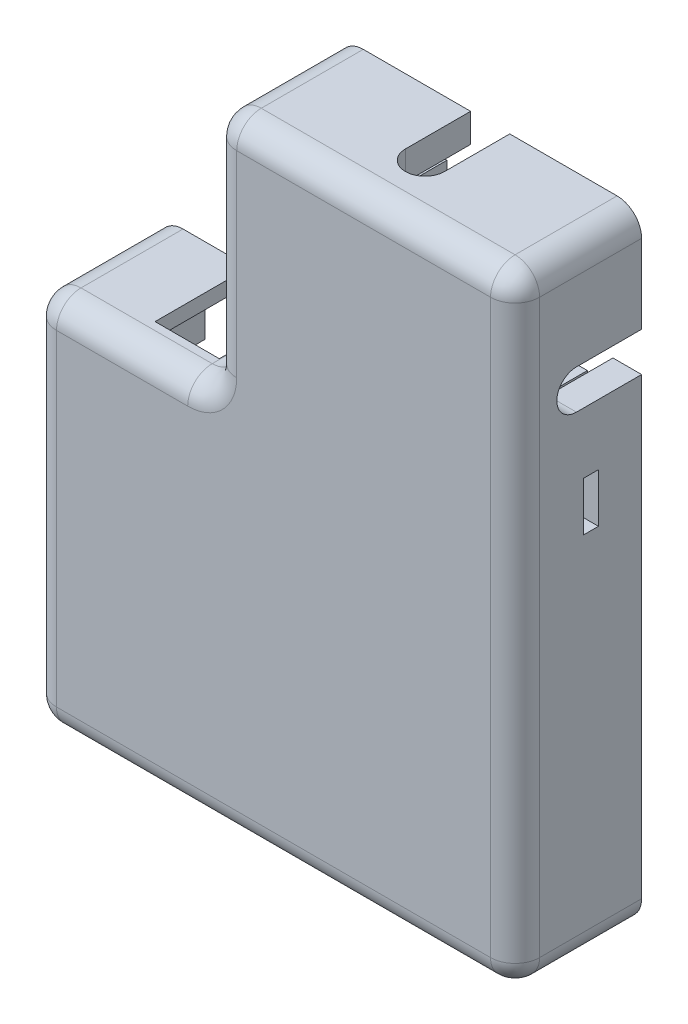
from build123d import *

# Parameters (mm, degrees)
BOSS_EXTRUDE1_DEPTH = 4
BOSS_EXTRUDE2_DEPTH = 21.8
BOSS_EXTRUDE3_START = 55.9
BOSS_EXTRUDE3_DEPTH = 5.85
BOSS_EXTRUDE4_START = 81.25
BOSS_EXTRUDE4_DEPTH = 5.85
SKETCH5_W           = 13.1
SKETCH5_H           = 3
BOSS_EXTRUDE5_DEPTH = 2.6
FILLET1_R           = 5
FILLET2_R           = 3
SKETCH6_W           = 3
SKETCH6_H           = 8.0544
SKETCH6_W_2         = 8.0544
SKETCH6_H_2         = 3
BOSS_EXTRUDE6_DEPTH = 0.889
FILLET3_R           = 3
FILLET4_R           = 1.4
FILLET5_R           = 1
SKETCH8_W           = 3
SKETCH8_H           = 10
CUT_EXTRUDE1_DEPTH  = 3
SKETCH9_W           = 3
SKETCH9_H           = 10
CUT_EXTRUDE2_DEPTH  = 3
SKETCH10_W          = 10
SKETCH10_H          = 3
CUT_EXTRUDE3_DEPTH  = 3


# Read off the part's stored shape, not the designer's step: Boss-Extrude3, Boss-Extrude4
# Some blends are built 0.0001 mm under size
with BuildPart() as part:
    # Sketch1 → Boss-Extrude1 (new body)
    with BuildSketch(Plane.XY):
        Polygon((-36.75, 37), (-36.75, -39.5), (61.75, -39.5), (61.75, 87.1), (0, 87.1), (0, 37), align=None)
    extrude(amount=BOSS_EXTRUDE1_DEPTH)

    # Sketch2 → Boss-Extrude2 (add)
    with BuildSketch(Plane(origin=(0, 0, 0), x_dir=(-1, 0, 0), z_dir=(0, 0, -1))):
        Polygon((5.15, 34), (-3, 34), (-3, 84.1), (-23.8825, 84.1), (-23.8825, 81.25), (-26.8825, 81.25), (-26.8825, 87.1), (0, 87.1), (0, 37), (5.15, 37), align=None)
        Polygon((-34.8675, 87.1), (-34.8675, 81.25), (-39.8459, 81.25), (-39.8459, 70.9282), (-22.0565, 70.9282), (-22.0565, 76.0456), (-19.0565, 76.0456), (-19.0565, 67.9282), (-42.5782, 67.9282), (-42.5782, 50.2315), (-50.6956, 50.2315), (-50.6956, 53.2315), (-45.5782, 53.2315), (-45.5782, 71.0209), (-55.9, 71.0209), (-55.9, 66.0425), (-61.75, 66.0425), (-61.75, 87.1), align=None)
        Polygon((-61.75, 58.0575), (-55.9, 58.0575), (-55.9, 55.0575), (-58.75, 55.0575), (-58.75, -36.5), (-29.25, -36.5), (-29.25, 19.052930988), (-27.25, 19.052930988), (-27.25, -36.5), (27.25, -36.5), (27.25, -22.2751), (33.75, -22.2751), (33.75, -24.2751), (36.75, -21.757801106), (36.75, -39.5), (-61.75, -39.5), align=None)
        Polygon((18.25, 37), (18.25, 34), (27.25, 34), (27.25, 19.7751), (33.75, 19.7751), (33.75, 21.7751), (36.75, 19.257801106), (36.75, 37), align=None)
    extrude(amount=BOSS_EXTRUDE2_DEPTH)

    # Boss-Extrude3 outline → Boss-Extrude3 (add)
    with BuildSketch(Plane.YZ.offset(BOSS_EXTRUDE3_START)):
        with BuildLine():
            Line((58.0575, 0), (58.0575, -8.509))
            ThreePointArc((58.0575, -8.509), (62.05, -4.5165), (66.0425, -8.509))
            Line((66.0425, -8.509), (66.0425, 0))
            Line((66.0425, 0), (58.0575, 0))
        make_face()
    extrude(amount=BOSS_EXTRUDE3_DEPTH)

    # Boss-Extrude4 outline → Boss-Extrude4 (add)
    with BuildSketch(Plane(origin=(0, 0, 0), x_dir=(1, 0, 0), z_dir=(0, 1, 0)).offset(BOSS_EXTRUDE4_START)):
        with BuildLine():
            Line((34.8675, 0), (34.8675, 8.509))
            ThreePointArc((34.8675, 8.509), (30.875, 4.5165), (26.8825, 8.509))
            Line((26.8825, 8.509), (26.8825, 0))
            Line((26.8825, 0), (34.8675, 0))
        make_face()
    extrude(amount=BOSS_EXTRUDE4_DEPTH)

    # Sketch5 → Boss-Extrude5 (add)
    with BuildSketch(Plane(origin=(0, 0, 0), x_dir=(-1, 0, 0), z_dir=(0, 0, -1))):
        with Locations((11.7, 35.5)):
            Rectangle(SKETCH5_W, SKETCH5_H)
    extrude(amount=BOSS_EXTRUDE5_DEPTH)

    # Fillet1
    # the kernel refuses this fillet: 5 mm, written as the material it adds along each edge
    with BuildSketch(Plane(origin=(0, 37, 4), x_dir=(0, 1, 0), z_dir=(0, 0, -1))) as fillet1_piece_1:
        with BuildLine():
            CenterArc((FILLET1_R, -FILLET1_R), FILLET1_R, 90, 90)
            Line((0, -FILLET1_R), (0, 0))
            Line((0, 0), (FILLET1_R, 0))
        make_face()
    extrude(amount=25.8)
    with BuildSketch(Plane(origin=(29.25, -36.5, 12.5), x_dir=(1, 0, 0), z_dir=(0, 0, -1))) as fillet1_piece_2_section:
        with BuildLine():
            CenterArc((FILLET1_R, -FILLET1_R), FILLET1_R, 90, 90)
            Line((0, -FILLET1_R), (0, 0))
            Line((0, 0), (FILLET1_R, 0))
        make_face()
    fillet1_piece_2 = extrude(amount=34.3, mode=Mode.PRIVATE)
    fillet1_piece_2 = split(fillet1_piece_2, bisect_by=Plane(origin=(30.366839695, -35.383160305, 4), z_dir=(0, 0, -1)), keep=Keep.TOP, mode=Mode.PRIVATE)
    add(fillet1_piece_2)
    with BuildSketch(Plane(origin=(58.75, -36.5, 12.5), x_dir=(0, 1, 0), z_dir=(0, 0, -1))) as fillet1_piece_3_section:
        with BuildLine():
            CenterArc((FILLET1_R, -FILLET1_R), FILLET1_R, 90, 90)
            Line((0, -FILLET1_R), (0, 0))
            Line((0, 0), (FILLET1_R, 0))
        make_face()
    fillet1_piece_3 = extrude(amount=34.3, mode=Mode.PRIVATE)
    fillet1_piece_3 = split(fillet1_piece_3, bisect_by=Plane(origin=(57.633160305, -35.383160305, 4), z_dir=(0, 0, -1)), keep=Keep.TOP, mode=Mode.PRIVATE)
    add(fillet1_piece_3)
    with BuildSketch(Plane(origin=(3, 84.1, 12.5), x_dir=(1, 0, 0), z_dir=(0, 0, -1))) as fillet1_piece_4_section:
        with BuildLine():
            CenterArc((FILLET1_R, FILLET1_R), FILLET1_R, 180, 90)
            Line((0, FILLET1_R), (0, 0))
            Line((0, 0), (FILLET1_R, 0))
        make_face()
    fillet1_piece_4 = extrude(amount=34.3, mode=Mode.PRIVATE)
    fillet1_piece_4 = split(fillet1_piece_4, bisect_by=Plane(origin=(4.116839695, 82.983160305, 4), z_dir=(0, 0, -1)), keep=Keep.TOP, mode=Mode.PRIVATE)
    add(fillet1_piece_4)
    # the kernel refuses this fillet: 5 mm, written as the material it takes off along each edge
    with BuildSketch(Plane(origin=(56.75, 82.1, -1), x_dir=(1, 0, 0), z_dir=(0, 0, 1))) as fillet1_2_piece_1_section:
        Polygon((0, 0), (FILLET1_R * 1.02, 0), (FILLET1_R * 1.02, FILLET1_R * 1.02), (0, FILLET1_R * 1.02), align=None)
    fillet1_2_piece_1 = extrude(amount=FILLET1_R * 1.02, mode=Mode.PRIVATE)
    fillet1_2_piece_1 = fillet1_2_piece_1 - Plane(origin=(56.75, 82.1, -1), x_dir=(-0.7071067811865475, -0.7071067811865477, 0), z_dir=(0, 0, 1)) * Sphere(FILLET1_R, mode=Mode.PRIVATE)
    add(fillet1_2_piece_1, mode=Mode.SUBTRACT)
    with BuildSketch(Plane(origin=(56.75, -34.5, -1), x_dir=(0, -1, 0), z_dir=(0, 0, 1))) as fillet1_2_piece_2_section:
        Polygon((0, 0), (FILLET1_R * 1.02, 0), (FILLET1_R * 1.02, FILLET1_R * 1.02), (0, FILLET1_R * 1.02), align=None)
    fillet1_2_piece_2 = extrude(amount=FILLET1_R * 1.02, mode=Mode.PRIVATE)
    fillet1_2_piece_2 = fillet1_2_piece_2 - Plane(origin=(56.75, -34.5, -1), x_dir=(-0.7071067811865476, 0.7071067811865475, 0), z_dir=(0, 0, 1)) * Sphere(FILLET1_R, mode=Mode.PRIVATE)
    add(fillet1_2_piece_2, mode=Mode.SUBTRACT)
    with BuildSketch(Plane(origin=(-31.75, -34.5, -1), x_dir=(0, 0, 1), z_dir=(-1, 0, 0))) as fillet1_2_piece_3_section:
        Polygon((0, 0), (FILLET1_R * 1.02, 0), (FILLET1_R * 1.02, -FILLET1_R * 1.02), (0, -FILLET1_R * 1.02), align=None)
    fillet1_2_piece_3 = extrude(amount=FILLET1_R * 1.02, mode=Mode.PRIVATE)
    fillet1_2_piece_3 = fillet1_2_piece_3 - Plane(origin=(-31.75, -34.5, -1), x_dir=(0, 0.7071067811865475, -0.7071067811865475), z_dir=(-1, 0, 0)) * Sphere(FILLET1_R, mode=Mode.PRIVATE)
    add(fillet1_2_piece_3, mode=Mode.SUBTRACT)
    with BuildSketch(Plane(origin=(56.75, 87.1, 4), x_dir=(0, -1, 0), z_dir=(-1, 0, 0))) as fillet1_2_piece_4:
        with BuildLine():
            CenterArc((FILLET1_R, -FILLET1_R), FILLET1_R, 90, 90)
            Line((0, -FILLET1_R), (0, 0))
            Line((0, 0), (FILLET1_R, 0))
        make_face()
    extrude(amount=69.25, mode=Mode.SUBTRACT)
    with BuildSketch(Plane(origin=(61.75, -34.5, 4), x_dir=(-1, 0, 0), z_dir=(0, 1, 0))) as fillet1_2_piece_5:
        with BuildLine():
            CenterArc((FILLET1_R, -FILLET1_R), FILLET1_R, 90, 90)
            Line((0, -FILLET1_R), (0, 0))
            Line((0, 0), (FILLET1_R, 0))
        make_face()
    extrude(amount=116.6, mode=Mode.SUBTRACT)
    with BuildSketch(Plane(origin=(-31.75, -39.5, 4), x_dir=(0, 1, 0), z_dir=(1, 0, 0))) as fillet1_2_piece_6:
        with BuildLine():
            CenterArc((FILLET1_R, -FILLET1_R), FILLET1_R, 90, 90)
            Line((0, -FILLET1_R), (0, 0))
            Line((0, 0), (FILLET1_R, 0))
        make_face()
    extrude(amount=88.5, mode=Mode.SUBTRACT)
    with BuildSketch(Plane(origin=(-36.75, 49.5, 4), x_dir=(0, 0, -1), z_dir=(0, -1, 0))) as fillet1_2_piece_7:
        with BuildLine():
            CenterArc((FILLET1_R, FILLET1_R), FILLET1_R, 180, 90)
            Line((0, FILLET1_R), (0, 0))
            Line((0, 0), (FILLET1_R, 0))
        make_face()
    extrude(amount=84, mode=Mode.SUBTRACT)
    with BuildSketch(Plane(origin=(-36.75, -39.5, -34.3), x_dir=(0, 1, 0), z_dir=(0, 0, 1)), Plane(origin=(61.75, 87.1, -34.3), x_dir=(0, -1, 0), z_dir=(0, 0, 1)), Plane(origin=(61.75, -39.5, -34.3), x_dir=(-1, 0, 0), z_dir=(0, 0, 1))) as fillet1_2_piece_8:
        with BuildLine():
            CenterArc((FILLET1_R, -FILLET1_R), FILLET1_R, 90, 90)
            Line((0, -FILLET1_R), (0, 0))
            Line((0, 0), (FILLET1_R, 0))
        make_face()
    extrude(amount=33.3, mode=Mode.SUBTRACT)
    with BuildSketch(Plane(origin=(-36.75, 37, 16.5), x_dir=(0, -1, 0), z_dir=(0, 0, -1))) as fillet1_2_piece_9:
        with BuildLine():
            CenterArc((FILLET1_R, -FILLET1_R), FILLET1_R, 90, 90)
            Line((0, -FILLET1_R), (0, 0))
            Line((0, 0), (FILLET1_R, 0))
        make_face()
    extrude(amount=50.8, mode=Mode.SUBTRACT)
    with BuildSketch(Plane(origin=(0, 87.1, 16.5), x_dir=(1, 0, 0), z_dir=(0, 0, -1))) as fillet1_2_piece_10:
        with BuildLine():
            CenterArc((FILLET1_R, FILLET1_R), FILLET1_R, 180, 90)
            Line((0, FILLET1_R), (0, 0))
            Line((0, 0), (FILLET1_R, 0))
        make_face()
    extrude(amount=50.8, mode=Mode.SUBTRACT)
    with BuildSketch(Plane(origin=(3, 34, 0), x_dir=(-1, 0, 0), z_dir=(0, 0, -1))) as fillet1_2_piece_11:
        with BuildLine():
            CenterArc((FILLET1_R, FILLET1_R), FILLET1_R, 180, 90)
            Line((0, FILLET1_R), (0, 0))
            Line((0, 0), (FILLET1_R, 0))
        make_face()
    extrude(amount=34.3, mode=Mode.SUBTRACT)
    # the kernel refuses this fillet: 5 mm, written as the material it takes off along each edge
    with BuildSketch(Plane(origin=(-31.75, 32, -1), x_dir=(0, 0, 1), z_dir=(0, 1, 0))) as fillet1_3_piece_1_section:
        Polygon((0, 0), (FILLET1_R * 1.02, 0), (FILLET1_R * 1.02, -FILLET1_R * 1.02), (0, -FILLET1_R * 1.02), align=None)
    fillet1_3_piece_1 = extrude(amount=FILLET1_R * 1.02, mode=Mode.PRIVATE)
    fillet1_3_piece_1 = fillet1_3_piece_1 - Plane(origin=(-31.75, 32, -1), x_dir=(0.7071067811865475, 0, -0.7071067811865475), z_dir=(0, 1, 0)) * Sphere(FILLET1_R, mode=Mode.PRIVATE)
    add(fillet1_3_piece_1, mode=Mode.SUBTRACT)
    with BuildSketch(Plane(origin=(5, 82.1, -1), x_dir=(-1, 0, 0), z_dir=(0, 0, 1))) as fillet1_3_piece_2_section:
        Polygon((0, 0), (FILLET1_R * 1.02, 0), (FILLET1_R * 1.02, -FILLET1_R * 1.02), (0, -FILLET1_R * 1.02), align=None)
    fillet1_3_piece_2 = extrude(amount=FILLET1_R * 1.02, mode=Mode.PRIVATE)
    fillet1_3_piece_2 = fillet1_3_piece_2 - Plane(origin=(5, 82.1, -1), x_dir=(0.7071067811865475, -0.7071067811865475, 0), z_dir=(0, 0, 1)) * Sphere(FILLET1_R, mode=Mode.PRIVATE)
    add(fillet1_3_piece_2, mode=Mode.SUBTRACT)
    with BuildSketch(Plane(origin=(0, 82.1, 4), x_dir=(1, 0, 0), z_dir=(0, -1, 0))) as fillet1_3_piece_3:
        with BuildLine():
            CenterArc((FILLET1_R, -FILLET1_R), FILLET1_R, 90, 90)
            Line((0, -FILLET1_R), (0, 0))
            Line((0, 0), (FILLET1_R, 0))
        make_face()
    extrude(amount=40.1, mode=Mode.SUBTRACT)
    with BuildSketch(Plane(origin=(-5, 37, 4), x_dir=(0, 0, -1), z_dir=(-1, 0, 0))) as fillet1_3_piece_4:
        with BuildLine():
            CenterArc((FILLET1_R, FILLET1_R), FILLET1_R, 180, 90)
            Line((0, FILLET1_R), (0, 0))
            Line((0, 0), (FILLET1_R, 0))
        make_face()
    extrude(amount=26.75, mode=Mode.SUBTRACT)
    with BuildSketch(Plane(origin=(-5, 42, 4), x_dir=(1, 0, 0), z_dir=(0, 1, 0))) as fillet1_3_piece_5:
        with BuildLine():
            CenterArc((5 + FILLET1_R, FILLET1_R), FILLET1_R, 180, 90)
            Line((5, FILLET1_R), (5, 0))
            Line((5, 0), (5 + FILLET1_R, 0))
        make_face()
    revolve(axis=Axis((-5, 42, 4), (0, 0, -1)), revolution_arc=90, mode=Mode.SUBTRACT)

    # Fillet2
    fillet2_edges = [part.edges().sort_by_distance(p)[0] for p in [
        (27.25, -36.5, -10.9),
        (-27.25, -36.5, -10.9),
    ]]
    fillet(fillet2_edges, radius=FILLET2_R)

    # Sketch6 → Boss-Extrude6 (add)
    with BuildSketch(Plane(origin=(0, 0, 0), x_dir=(-1, 0, 0), z_dir=(0, 0, -1))):
        with Locations((-20.5565, 80.0728)):
            Rectangle(SKETCH6_W, SKETCH6_H)
        with Locations((-54.7228, 51.7315)):
            Rectangle(SKETCH6_W_2, SKETCH6_H_2)
    extrude(amount=BOSS_EXTRUDE6_DEPTH)

    # Fillet3
    fillet3_edges = [part.edges().sort_by_distance(p)[0] for p in [
        (19.0565, 67.9282, -10.9),
        (42.5782, 67.9282, -10.9),
        (42.5782, 50.2315, -10.9),
    ]]
    fillet(fillet3_edges, radius=FILLET3_R)

    # Fillet4
    fillet4_edges = [part.edges().sort_by_distance(p)[0] for p in [
        (23.8825, 84.1, -10.9),
        (23.8825, 81.25, -10.9),
        (55.9, 55.0575, -10.9),
        (58.75, 55.0575, -10.9),
    ]]
    fillet(fillet4_edges, radius=FILLET4_R)

    # Fillet5
    fillet5_edges = [part.edges().sort_by_distance(p)[0] for p in [
        (29.25, 19.052930988, -10.9),
        (27.25, 19.052930988, -10.9),
    ]]
    fillet(fillet5_edges, radius=FILLET5_R - 0.0001)  # a hair under: the kernel refuses the full size

    # Sketch8 → Cut-Extrude1 (cut)
    with BuildSketch(Plane.ZY.offset(-58.75)):
        with Locations((-11.5, 40.6575)):
            Rectangle(SKETCH8_W, SKETCH8_H)
    extrude(amount=-CUT_EXTRUDE1_DEPTH, mode=Mode.SUBTRACT)

    # Sketch9 → Cut-Extrude2 (cut)
    with BuildSketch(Plane(origin=(3, 0, 0), x_dir=(0, 0, -1), z_dir=(1, 0, 0))):
        with Locations((11.5, 59.05)):
            Rectangle(SKETCH9_W, SKETCH9_H)
    extrude(amount=-CUT_EXTRUDE2_DEPTH, mode=Mode.SUBTRACT)

    # Sketch10 → Cut-Extrude3 (cut)
    with BuildSketch(Plane(origin=(0, -36.5, 0), x_dir=(1, 0, 0), z_dir=(0, 1, 0))):
        with Locations((-13.25, 11.5)):
            Rectangle(SKETCH10_W, SKETCH10_H)
    extrude(amount=-CUT_EXTRUDE3_DEPTH, mode=Mode.SUBTRACT)


solid = part.part
